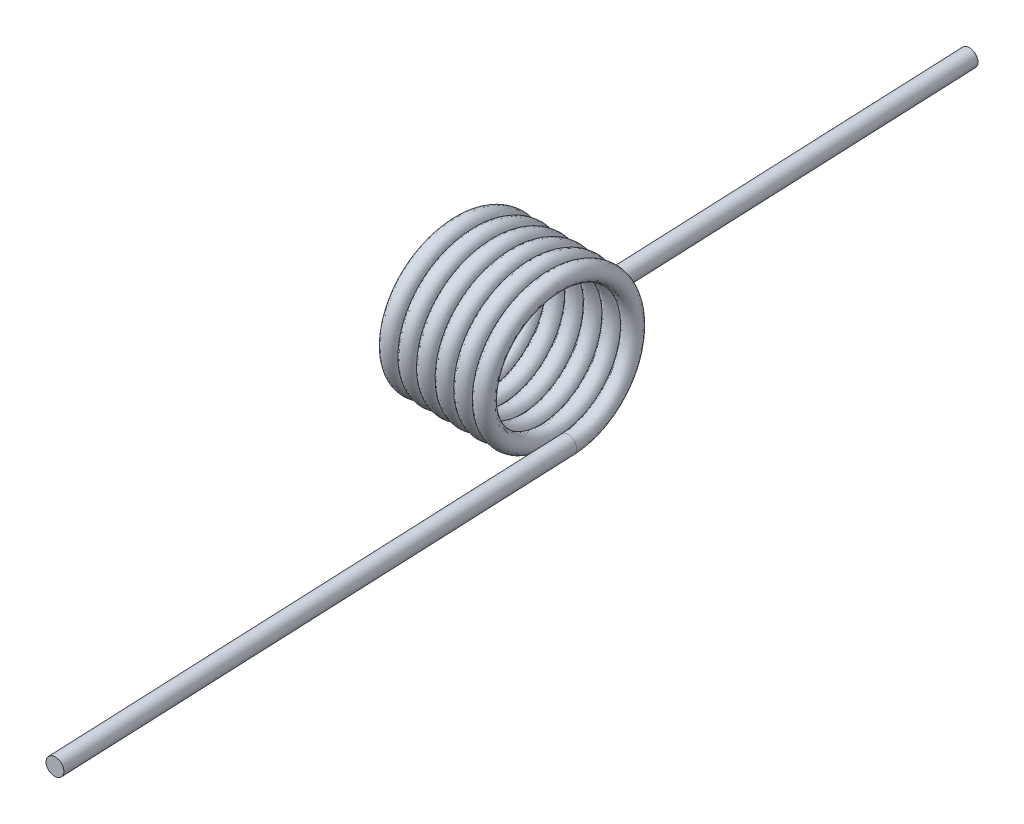
from build123d import *

# Parameters (mm, degrees)
SWEEP1_PITCH       = 0.3302
SWEEP1_HEIGHT      = 1.9812
SWEEP1_RADIUS      = 1.2319
SWEEP1_START_ANGLE = 90
SKETCH3_R          = 0.1524
SKETCH4_R          = 0.1524
EXTRUDE1_DEPTH     = 9.525
SKETCH5_R          = 0.1524
EXTRUDE2_DEPTH     = 9.525


with BuildPart() as part:
    # Sweep1: sweep along a helix
    with BuildLine() as sweep1_path:
        add(Helix(SWEEP1_PITCH, SWEEP1_HEIGHT, SWEEP1_RADIUS, center=(0, 0, 0), direction=(-1, 0, 0), lefthand=True, mode=Mode.PRIVATE).rotate(Axis((0, 0, 0), (-1, 0, 0)), SWEEP1_START_ANGLE))
    # Sketch3 → Sweep1 (sweep)
    with BuildSketch(Plane(origin=(0, -1.2319, 0), x_dir=(0.998821548611417, -0.023236129092747755, -0.042609814999313864), z_dir=(-0.0426213225559274, 1.0817085074887878e-14, -0.9990912985626407))):
        Circle(SKETCH3_R)
    sweep(path=sweep1_path.line, is_frenet=True)

    # Sketch4 → Extrude1 (add)
    with BuildSketch(Plane(origin=(0, 0, 0), x_dir=(-0.998821548611417, 0.023236129092747786, 0.04260981499931387), z_dir=(0.042621322555927404, -1.0816651394018887e-14, 0.9990912985626408))):
        with Locations(Location((-0.028624587, 1.231567393, 0), (0, 0, 1.33145196))):
            Circle(SKETCH4_R)
    extrude(amount=EXTRUDE1_DEPTH)

    # Sketch5 → Extrude2 (add)
    with BuildSketch(Plane(origin=(-0.003599003, 0, -0.084364632), x_dir=(0.997813982147795, 0.050550191227749446, -0.04256683212546703), z_dir=(-0.0426213225559274, 9.444094811739132e-14, -0.9990912985626407))):
        with Locations(Location((-2.039141842, 1.13026601, 0), (0, 0, 182.897547533))):
            Circle(SKETCH5_R)
    extrude(amount=EXTRUDE2_DEPTH)


solid = part.part
